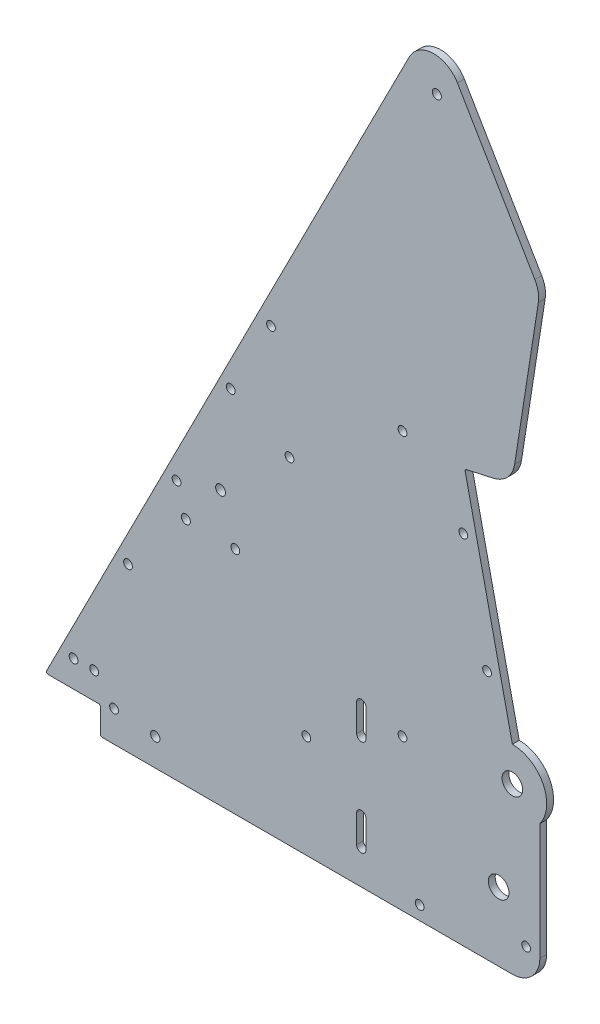
from build123d import *

# Parameters (mm, degrees)
BOSS_EXTRUDE1_DEPTH = 3.175
SKETCH2_R           = 2.0955
SKETCH2_R_2         = 2.286
SKETCH2_R_3         = 2.032
SKETCH2_R_4         = 4.7625
CUT_EXTRUDE1_DEPTH  = 421.976111717
SKETCH7_R           = 2.159
CUT_EXTRUDE2_DEPTH  = 421.976111717
CUT_EXTRUDE3_REACH  = 422.976
SKETCH10_R          = 2.032
FILLET1_R           = 12.7
FILLET2_R           = 0.79375
SKETCH12_R          = 2.032
CUT_EXTRUDE5_DEPTH  = 410.593447353
SKETCH13_R          = 2.032
CUT_EXTRUDE6_DEPTH  = 410.593447353


with BuildPart() as part:
    # Sketch1 → Boss-Extrude1 (new body)
    with BuildSketch(Plane.XY):
        with BuildLine():
            Line((228.6, -12.7), (228.6, 53.975))
            ThreePointArc((228.6, 53.975), (230.099031657, 70.599515829), (215.9, 79.375))
            Line((215.9, 79.375), (193.909735224, 178.566674323))
            Line((193.909735224, 178.566674323), (215.607913982, 183.377044743))
            Line((215.607913982, 183.377044743), (228.6, 266.7))
            Line((228.6, 266.7), (178.754725958, 351.413083686))
            Line((178.754725958, 351.413083686), (0, 0))
            Line((0, 0), (25.4, 0))
            Line((25.4, 0), (25.4, -12.7))
            Line((25.4, -12.7), (228.6, -12.7))
        make_face()
    extrude(amount=BOSS_EXTRUDE1_DEPTH)

    # Sketch2 → Cut-Extrude1 (cut, through all)
    with BuildSketch(Plane.XY.offset(3.175)):
        with Locations((64.943150167, 94.057839899)):
            Circle(SKETCH2_R)
        with Locations((180.975, 322.164313376)):
            Circle(SKETCH2_R)
        with Locations((81.00705334, 113.73297687)):
            Circle(SKETCH2_R_2)
        with Locations((193.207821773, 152.394364194)):
            Circle(SKETCH2_R_3)
        with Locations((215.9, 63.5)):
            Circle(SKETCH2_R_4)
        with Locations((173.0375, -6.35)):
            Circle(SKETCH2_R_3)
        with Locations((204.202954161, 102.798527032)):
            Circle(SKETCH2_R_3)
        with Locations((209.55, 19.05)):
            Circle(SKETCH2_R_4)
        with Locations((60.657757175, 107.341986975)):
            Circle(SKETCH2_R_3)
        with Locations((165.1, 179.3875)):
            Circle(SKETCH2_R_3)
        with Locations((87.824985877, 93.522721993)):
            Circle(SKETCH2_R_3)
        with Locations((112.872403657, 142.763324016)):
            Circle(SKETCH2_R_3)
        with Locations((85.705174955, 156.582588998)):
            Circle(SKETCH2_R_3)
    extrude(amount=-CUT_EXTRUDE1_DEPTH, mode=Mode.SUBTRACT)

    # Sketch7 → Cut-Extrude2 (cut, through all)
    with BuildSketch(Plane.XY.offset(3.175)):
        with Locations((50.8, 0)):
            Circle(SKETCH7_R)
        with BuildLine():
            Line((143.891, 3.175), (143.891, 15.875))
            ThreePointArc((143.891, 15.875), (146.05, 18.034), (148.209, 15.875))
            Line((148.209, 15.875), (148.209, 3.175))
            ThreePointArc((148.209, 3.175), (146.05, 1.016), (143.891, 3.175))
        make_face()
        with BuildLine():
            Line((143.891, 47.625), (143.891, 60.325))
            ThreePointArc((143.891, 60.325), (146.05, 62.484), (148.209, 60.325))
            Line((148.209, 60.325), (148.209, 47.625))
            ThreePointArc((148.209, 47.625), (146.05, 45.466), (143.891, 47.625))
        make_face()
    extrude(amount=-CUT_EXTRUDE2_DEPTH, mode=Mode.SUBTRACT)

    # Sketch10 → Cut-Extrude3 (cut, up to next)
    with BuildSketch(Plane.XY.offset(3.175), mode=Mode.PRIVATE) as cut_extrude3_sk1:
        with Locations((120.65, 34.925)):
            Circle(SKETCH10_R)
    cut_extrude3_tool1 = extrude(cut_extrude3_sk1.sketch, amount=-CUT_EXTRUDE3_REACH, mode=Mode.PRIVATE) & part.part
    # Sketch10 → Cut-Extrude3 (cut, up to next)
    with BuildSketch(Plane.XY.offset(3.175), mode=Mode.PRIVATE) as cut_extrude3_sk2:
        with Locations((165.1, 57.15)):
            Circle(SKETCH10_R)
    cut_extrude3_tool2 = extrude(cut_extrude3_sk2.sketch, amount=-CUT_EXTRUDE3_REACH, mode=Mode.PRIVATE) & part.part
    # Sketch10 → Cut-Extrude3 (cut, up to next)
    with BuildSketch(Plane.XY.offset(3.175), mode=Mode.PRIVATE) as cut_extrude3_sk3:
        with Locations((13.046467246, 12.334704411)):
            Circle(SKETCH10_R)
    cut_extrude3_tool3 = extrude(cut_extrude3_sk3.sketch, amount=-CUT_EXTRUDE3_REACH, mode=Mode.PRIVATE) & part.part
    # Sketch10 → Cut-Extrude3 (cut, up to next)
    with BuildSketch(Plane.XY.offset(3.175), mode=Mode.PRIVATE) as cut_extrude3_sk4:
        with Locations((22.571467246, 12.334704411)):
            Circle(SKETCH10_R)
    cut_extrude3_tool4 = extrude(cut_extrude3_sk4.sketch, amount=-CUT_EXTRUDE3_REACH, mode=Mode.PRIVATE) & part.part
    # Sketch10 → Cut-Extrude3 (cut, up to next)
    with BuildSketch(Plane.XY.offset(3.175), mode=Mode.PRIVATE) as cut_extrude3_sk5:
        with Locations((38.211447917, 62.639810909)):
            Circle(SKETCH10_R)
    cut_extrude3_tool5 = extrude(cut_extrude3_sk5.sketch, amount=-CUT_EXTRUDE3_REACH, mode=Mode.PRIVATE) & part.part
    add(cut_extrude3_tool1.solids().sort_by_distance((120.65, 34.925, 3.175))[0], mode=Mode.SUBTRACT)
    add(cut_extrude3_tool2.solids().sort_by_distance((165.1, 57.15, 3.175))[0], mode=Mode.SUBTRACT)
    add(cut_extrude3_tool3.solids().sort_by_distance((13.046467, 12.334704, 3.175))[0], mode=Mode.SUBTRACT)
    add(cut_extrude3_tool4.solids().sort_by_distance((22.571467, 12.334704, 3.175))[0], mode=Mode.SUBTRACT)
    add(cut_extrude3_tool5.solids().sort_by_distance((38.211448, 62.639811, 3.175))[0], mode=Mode.SUBTRACT)

    # Fillet1
    fillet1_edges = [part.edges().sort_by_distance(p)[0] for p in [
        (228.6, -12.7, 1.5875),
        (178.754725958, 351.413083686, 1.5875),
        (215.607913982, 183.377044743, 1.5875),
        (228.6, 266.7, 1.5875),
    ]]
    fillet(fillet1_edges, radius=FILLET1_R)

    # Fillet2
    fillet2_edges = [part.edges().sort_by_distance(p)[0] for p in [
        (25.4, -12.7, 1.5875),
        (25.4, 0, 1.5875),
        (193.909735224, 178.566674323, 1.5875),
        (0, 0, 1.5875),
    ]]
    fillet(fillet2_edges, radius=FILLET2_R)

    # Sketch12 → Cut-Extrude5 (cut, through all)
    with BuildSketch(Plane.XY.offset(3.175)):
        with Locations((31.75, 1.5875)):
            Circle(SKETCH12_R)
        with Locations((173.0375, -6.35)):
            Circle(SKETCH12_R)
        with Locations((222.25, 1.5875)):
            Circle(SKETCH12_R)
    extrude(amount=-CUT_EXTRUDE5_DEPTH, mode=Mode.SUBTRACT)

    # Sketch13 → Cut-Extrude6 (cut, through all)
    with BuildSketch(Plane.XY.offset(3.175)):
        with Locations((104.321757764, 191.07999269)):
            Circle(SKETCH13_R)
    extrude(amount=-CUT_EXTRUDE6_DEPTH, mode=Mode.SUBTRACT)


solid = part.part
